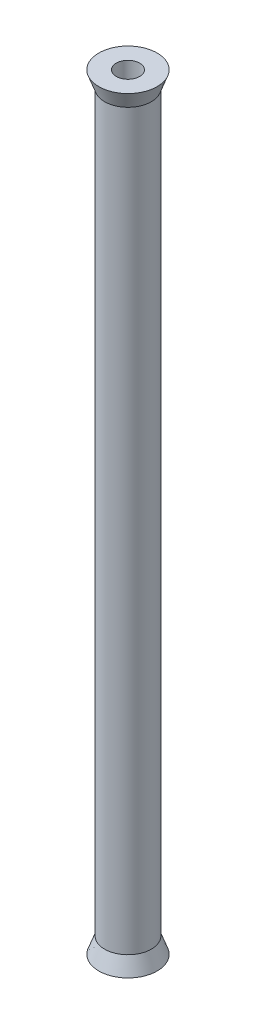
from build123d import *


with BuildPart() as part:
    # Sketch1 → Revolve1 (revolve)
    with BuildSketch(Plane.XY):
        Polygon((2, -65.7), (5, -65.7), (4, -62.952522581), (4, 62.952522581), (5, 65.7), (2, 65.7), align=None)
    revolve(axis=Axis((0, 0, 0), (0, -1, 0)))


solid = part.part
